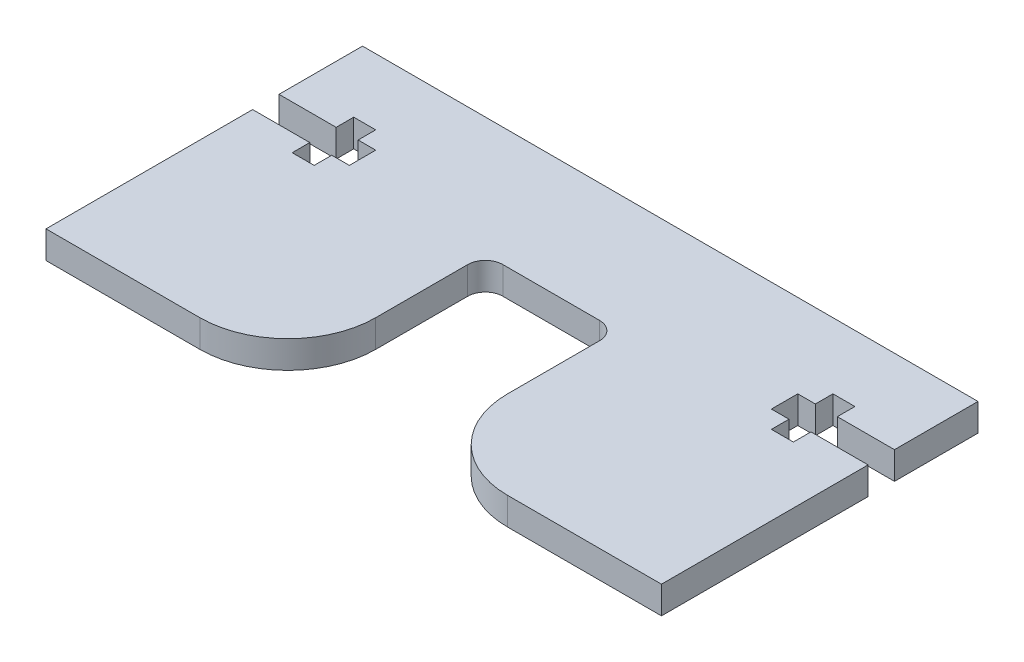
from build123d import *

# Parameters (mm, degrees)
BOSS_EXTRUDE1_DEPTH = 1.5625
SKETCH2_W           = 15
SKETCH2_H           = 22.4625
CUT_EXTRUDE1_DEPTH  = 51.306715506
FILLET1_R           = 10
FILLET2_R           = 2


with BuildPart() as part:
    # Sketch1 → Boss-Extrude1 (new, symmetric)
    with BuildSketch(Plane(origin=(0, 0, 0), x_dir=(1, 0, 0), z_dir=(0, 1, 0))):
        Polygon((0, 36), (35, 36), (35, 26.5), (28.5, 26.5), (28.5, 28.5), (26, 28.5), (26, 26.5), (24, 26.5), (24, 23.5), (26, 23.5), (26, 21.5), (28.5, 21.5), (28.5, 23.5), (35, 23.5), (35, 0), (0, 0), align=None)
    boss_extrude1 = extrude(amount=BOSS_EXTRUDE1_DEPTH, both=True)

    # Mirror1: Boss-Extrude1 across plane
    add(boss_extrude1.mirror(Plane(origin=(0, 0, 0), x_dir=(0, 0, 1), z_dir=(1, 0, 0))))

    # Sketch2 → Cut-Extrude1 (cut, through all)
    with BuildSketch(Plane.XZ.offset(1.5625)):
        with Locations((0, -11.23125)):
            Rectangle(SKETCH2_W, SKETCH2_H)
    extrude(amount=-CUT_EXTRUDE1_DEPTH, mode=Mode.SUBTRACT)

    # Fillet1
    fillet1_edges = [part.edges().sort_by_distance(p)[0] for p in [
        (-7.5, 0, 0),
        (7.5, 0, 0),
    ]]
    fillet(fillet1_edges, radius=FILLET1_R)

    # Fillet2
    fillet2_edges = [part.edges().sort_by_distance(p)[0] for p in [
        (7.5, 0, -22.4625),
        (-7.5, 0, -22.4625),
    ]]
    fillet(fillet2_edges, radius=FILLET2_R)


solid = part.part
